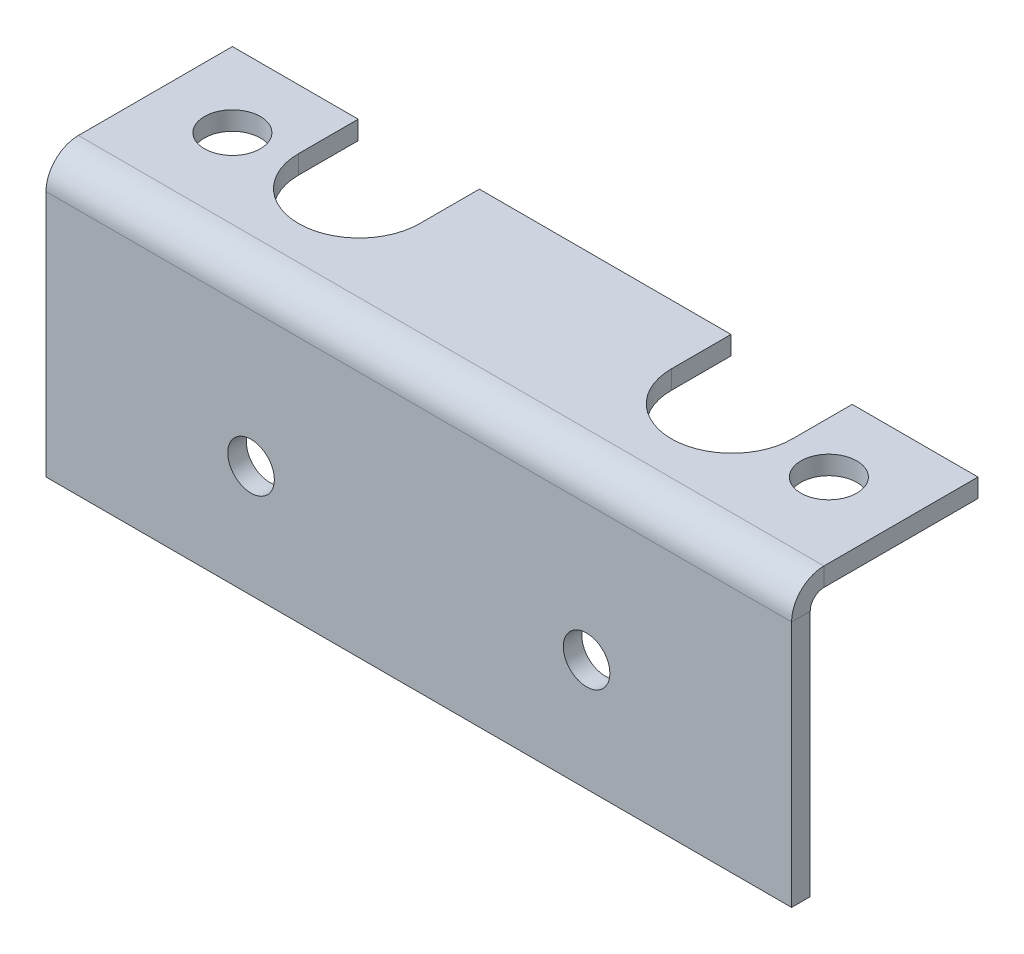
from build123d import *

# Parameters (mm, degrees)
SZKIC1_W                           = 40
SZKIC1_H                           = 15
ODGI_CIE_BAZOWE1_DEPTH             = 1
ODGI_CIE_KRAW_DZI1_STRIP_W         = 5.4732
ODGI_CIE_KRAW_DZI1_STRIP_H         = 1
ODGI_CIE_KRAW_DZI1_STRIP_CUT_DEPTH = 40
ODGI_CIE_KRAW_DZI1_DEPTH           = 40
OTW_R_GWINTOWANY_M3X0_51_D         = 2.5
WYTNIJ_WYCI_GNI_CIE1_DEPTH         = 27.381811917
OTWORY_USTALAJ_CE_3_0MM1_D         = 3


# Sheet-metal steps are written as plain solids
with BuildPart() as part:
    # Szkic1 → Odgięcie bazowe1 (new body)
    with BuildSketch(Plane.XY):
        Rectangle(SZKIC1_W, SZKIC1_H)
    extrude(amount=-ODGI_CIE_BAZOWE1_DEPTH)

    # Odgięcie krawędzi1 strip (across the edge) → Odgięcie krawędzi1 strip cut (cut)
    with BuildSketch(Plane(origin=(-20, 7.5, -1), x_dir=(0, -1, 0), z_dir=(1, 0, 0))):
        with Locations((-1, -0.5)):
            Rectangle(ODGI_CIE_KRAW_DZI1_STRIP_W, ODGI_CIE_KRAW_DZI1_STRIP_H)
    extrude(amount=ODGI_CIE_KRAW_DZI1_STRIP_CUT_DEPTH, mode=Mode.SUBTRACT)

    # Odgięcie krawędzi1 section (across the edge) → Odgięcie krawędzi1 (add)
    with BuildSketch(Plane(origin=(-20, 7.5, -1), x_dir=(0, -1, 0), z_dir=(1, 0, 0))):
        with BuildLine():
            Line((0, 0.7366), (0, 9))
            Line((0, 9), (1, 9))
            Line((1, 9), (1, 0.7366))
            ThreePointArc((1, 0.7366), (1.215745145, 0.215745145), (1.7366, 0))
            Line((1.7366, 0), (1.7366, -1))
            ThreePointArc((1.7366, -1), (0.508638364, -0.491361636), (0, 0.7366))
        make_face()
    extrude(amount=ODGI_CIE_KRAW_DZI1_DEPTH)

    # Otwór gwintowany M3x0.51 (through all)
    with Locations(Plane.XY):
        with Locations((-9, -1.5), (9, -1.5)):
            Hole(OTW_R_GWINTOWANY_M3X0_51_D / 2)

    # Szkic11 → Wytnij-wyciągnięcie1 (cut, through all)
    with BuildSketch(Plane.XZ.offset(-6.5)):
        with BuildLine():
            ThreePointArc((-10.567890835, -10), (-12.490797584, -8.887684697), (-13.25, -6.8))
            Line((-13.25, -6.8), (-13.25, -10))
            Line((-13.25, -10), (-10.567890835, -10))
        make_face()
        with BuildLine():
            Line((-6.75, -10), (-6.75, -6.8))
            ThreePointArc((-6.75, -6.8), (-7.509202416, -8.887684697), (-9.432109165, -10))
            Line((-9.432109165, -10), (-6.75, -10))
        make_face()
        with BuildLine():
            ThreePointArc((-6.75, -6.8), (-10, -3.55), (-13.25, -6.8))
            ThreePointArc((-13.25, -6.8), (-12.490797584, -8.887684697), (-10.567890835, -10))
            Line((-10.567890835, -10), (-9.432109165, -10))
            ThreePointArc((-9.432109165, -10), (-7.509202416, -8.887684697), (-6.75, -6.8))
        make_face()
        with BuildLine():
            Line((-9.432109165, -10), (-10.567890835, -10))
            ThreePointArc((-10.567890835, -10), (-10, -10.05), (-9.432109165, -10))
        make_face()
        with BuildLine():
            ThreePointArc((13.25, -6.8), (10, -3.55), (6.75, -6.8))
            ThreePointArc((6.75, -6.8), (7.509202416, -8.887684697), (9.432109165, -10))
            Line((9.432109165, -10), (10.567890835, -10))
            ThreePointArc((10.567890835, -10), (12.490797584, -8.887684697), (13.25, -6.8))
        make_face()
        with BuildLine():
            Line((10.567890835, -10), (9.432109165, -10))
            ThreePointArc((9.432109165, -10), (10, -10.05), (10.567890835, -10))
        make_face()
        with BuildLine():
            Line((6.75, -6.8), (6.75, -10))
            Line((6.75, -10), (9.432109165, -10))
            ThreePointArc((9.432109165, -10), (7.509202416, -8.887684697), (6.75, -6.8))
        make_face()
        with BuildLine():
            Line((13.25, -10), (13.25, -6.8))
            ThreePointArc((13.25, -6.8), (12.490797584, -8.887684697), (10.567890835, -10))
            Line((10.567890835, -10), (13.25, -10))
        make_face()
    extrude(amount=-WYTNIJ_WYCI_GNI_CIE1_DEPTH, mode=Mode.SUBTRACT)

    # Otwory ustalające Ø3.0mm1 (through all)
    with Locations(Plane(origin=(0, 6.5, 0), x_dir=(-1, 0, 0), z_dir=(0, -1, 0))):
        with Locations((16, 6), (-16, 6)):
            Hole(OTWORY_USTALAJ_CE_3_0MM1_D / 2)


solid = part.part
